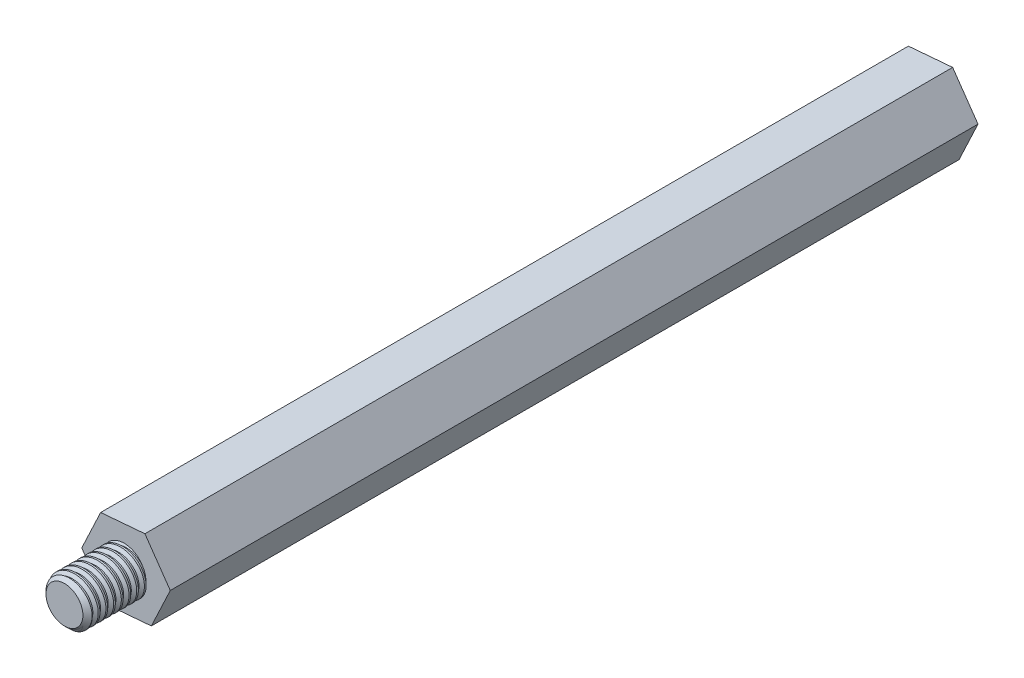
from build123d import *

# Parameters (mm, degrees)
EXTRUDE_1_DEPTH        = 52.5
HOLE_WIZARD_M3_1_D     = 2.5
HOLE_WIZARD_M3_1_DEPTH = 15
HOLE_WIZARD_M3_1_TIP   = 0.751075774
SKETCH_3_R             = 1.5
EXTRUDE_2_DEPTH        = 4
CHAMFER_1_SIZE         = 0.3
SWEEP_2_PITCH          = 0.5
SWEEP_2_TO             = 4


with BuildPart() as part:
    # 草图1 → 凸台-拉伸1 (new body)
    with BuildSketch(Plane.XY):
        Polygon((1.647343323, -2.37056814), (2.876643893, 0.241357097), (1.229300569, 2.611925237), (-1.647343323, 2.37056814), (-2.876643893, -0.241357097), (-1.229300569, -2.611925237), align=None)
    extrude(amount=EXTRUDE_1_DEPTH)

    # M3 螺纹孔1
    with Locations(Plane(origin=(0, 0, 0), x_dir=(-1, 0, 0), z_dir=(0, 0, -1))):
        with Locations((0, 0)):
            Hole(HOLE_WIZARD_M3_1_D / 2, depth=HOLE_WIZARD_M3_1_DEPTH)
            with Locations((0, 0, -(HOLE_WIZARD_M3_1_DEPTH + HOLE_WIZARD_M3_1_TIP / 2))):  # 118° drill point
                Cone(0, HOLE_WIZARD_M3_1_D / 2, HOLE_WIZARD_M3_1_TIP, mode=Mode.SUBTRACT)

    # 草图3 → 凸台-拉伸2 (add)
    with BuildSketch(Plane.XY.offset(52.5)):
        Circle(SKETCH_3_R)
    extrude(amount=EXTRUDE_2_DEPTH)

    # 倒角1
    chamfer_1_edges = [part.edges().sort_by_distance(p)[0] for p in [
        (-1.5, 0, 56.5),
    ]]
    chamfer(chamfer_1_edges, length=CHAMFER_1_SIZE)

    # 切除-扫描2: arcs per turn and ends read off the stored shape
    # 切除-扫描2: the profile of 草图5 screwed along a right-hand helix through 8.666667 turns, 6 arcs to a turn; built about Z, then put on its axis
    sweep_2_z = Axis((0, 0, 0), (0, 0, 1))
    sweep_2_corners = [(1.543237988, 0, -0.225), (1.543237988, 0, 0.225), (1.293237988, 0, 0.05), (1.293237988, 0, -0.05)]
    with BuildLine(mode=Mode.PRIVATE) as sweep_2_profile:
        Line(sweep_2_corners[0], sweep_2_corners[1])
        Line(sweep_2_corners[1], sweep_2_corners[2])
        Line(sweep_2_corners[2], sweep_2_corners[3])
        Line(sweep_2_corners[3], sweep_2_corners[0])
    sweep_2_cap = Face(sweep_2_profile.wire())
    sweep_2_turn_angles = [0, 30, 60, 90, 120, 150, 180, 210, 240, 270, 300, 330, 360]
    sweep_2_turn_weights = [1, 0.8660254037844387, 1, 0.8660254037844387, 1, 0.8660254037844387, 1, 0.8660254037844387, 1, 0.8660254037844387, 1, 0.8660254037844387, 1]
    sweep_2_turn_rails = [Edge.make_bspline([Vector(p[0], p[1], 0).rotate(sweep_2_z, sweep_2_turn_angles[k]) / sweep_2_turn_weights[k] + Vector(0, 0, p[2] + SWEEP_2_PITCH * sweep_2_turn_angles[k] / 360) for k in range(13)], [0, 0, 0, 1, 1, 2, 2, 3, 3, 4, 4, 5, 5, 6, 6, 6], 2, sweep_2_turn_weights) for p in sweep_2_corners]
    sweep_2_turn_sides = [Face.make_surface_from_curves(sweep_2_turn_rails[p[0]], sweep_2_turn_rails[p[1]]) for p in [(0, 1), (1, 2), (2, 3), (3, 0)]]
    sweep_2_last_angles = [2880, 2910, 2940, 2970, 3000, 3030, 3060, 3090, 3120]
    sweep_2_last_weights = [1, 0.8660254037844387, 1, 0.8660254037844387, 1, 0.8660254037844387, 1, 0.8660254037844387, 1]
    sweep_2_last_rails = [Edge.make_bspline([Vector(p[0], p[1], 0).rotate(sweep_2_z, sweep_2_last_angles[k]) / sweep_2_last_weights[k] + Vector(0, 0, p[2] + SWEEP_2_PITCH * sweep_2_last_angles[k] / 360) for k in range(9)], [0, 0, 0, 1, 1, 2, 2, 3, 3, 4, 4, 4], 2, sweep_2_last_weights) for p in sweep_2_corners]
    sweep_2_last_sides = [Face.make_surface_from_curves(sweep_2_last_rails[p[0]], sweep_2_last_rails[p[1]]) for p in [(0, 1), (1, 2), (2, 3), (3, 0)]]
    sweep_2 = Plane(origin=(0, 0, 56.5), x_dir=(1, 0, 0), z_dir=(0, 0, -1)) * split(Solid(Shell([*[p.moved(Location((0, 0, SWEEP_2_PITCH * i))) for i in range(8) for p in sweep_2_turn_sides], *sweep_2_last_sides, sweep_2_cap, sweep_2_cap.rotate(sweep_2_z, 3120).moved(Location((0, 0, SWEEP_2_PITCH * 3120 / 360)))])), bisect_by=Plane.XY.offset(SWEEP_2_TO), keep=Keep.BOTTOM, mode=Mode.PRIVATE)
    add(sweep_2, mode=Mode.SUBTRACT)


solid = part.part
